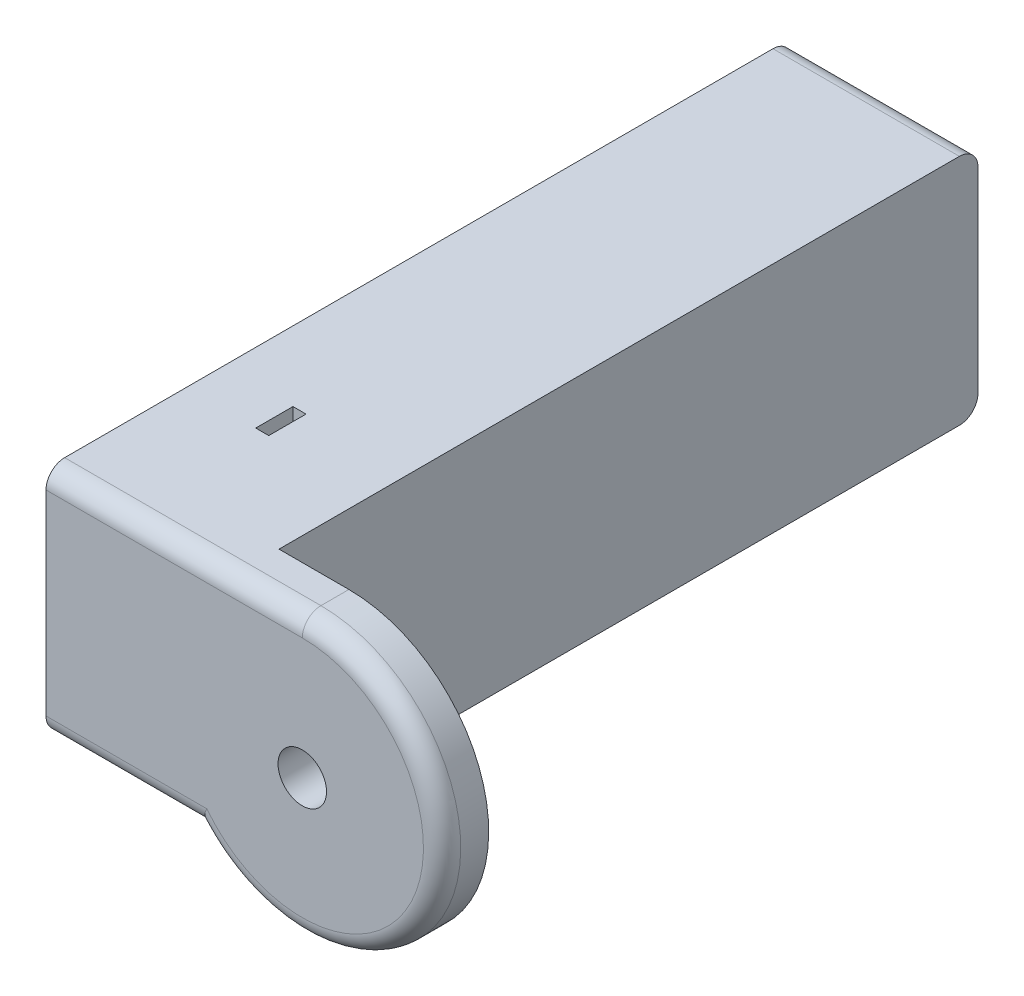
from build123d import *

# Parameters (mm, degrees)
SKETCH1_W             = 25.4
SKETCH1_H             = 101.6
TOP_DEPTH             = 4.7625
SKETCH2_W             = 25.4
SKETCH2_H             = 101.6
SKETCH2_W_2           = 15.875
SKETCH2_H_2           = 88.9
WALLS_DEPTH           = 31.75
SKETCH9_R             = 3.302
JOINT_HINGE_DEPTH     = 6.35
SKETCH3_R             = 3.175
SHAFT_HOLES_DEPTH     = 23.876
SKETCH13_W            = 1.778
SKETCH13_H            = 5.08
WIRE_LOFT_MOUNT_DEPTH = 12.7
FILLET1_R             = 2.54


with BuildPart() as part:
    # Sketch1 → Top (new body)
    with BuildSketch(Plane(origin=(0, 0, 0), x_dir=(1, 0, 0), z_dir=(0, 1, 0))):
        Rectangle(SKETCH1_W, SKETCH1_H)
    extrude(amount=TOP_DEPTH)

    # Sketch2 → Walls (add)
    with BuildSketch(Plane(origin=(0, 4.7625, 0), x_dir=(1, 0, 0), z_dir=(0, 1, 0))):
        Rectangle(SKETCH2_W, SKETCH2_H)
        Rectangle(SKETCH2_W_2, SKETCH2_H_2, mode=Mode.SUBTRACT)
    extrude(amount=-WALLS_DEPTH)

    # Sketch9 → Joint Hinge (add)
    with BuildSketch(Plane(origin=(0, 0, 50.8), x_dir=(-1, 0, 0), z_dir=(0, 0, -1))):
        with BuildLine():
            Line((-22.225, 4.7625), (-12.7, 4.7625))
            Line((-12.7, 4.7625), (-12.7, -26.9875))
            Line((-12.7, -26.9875), (-8.025968343, -26.9875))
            ThreePointArc((-8.025968343, -26.9875), (-39.615191201, -22.064629933), (-22.225, 4.7625))
        make_face()
        with Locations((-22.225, -14.2875)):
            Circle(SKETCH9_R, mode=Mode.SUBTRACT)
    extrude(amount=JOINT_HINGE_DEPTH)

    # Sketch3 → Shaft holes (cut)
    with BuildSketch(Plane.ZY.offset(12.7)):
        with Locations((38.1, -11.1125)):
            Circle(SKETCH3_R)
        with BuildLine():
            Line((-25.601638938, -12.7), (-23.061638938, -12.7))
            Line((-23.061638938, -12.7), (-23.061638938, -9.525))
            Line((-23.061638938, -9.525), (-25.601638938, -9.525))
            ThreePointArc((-25.601638938, -9.525), (-38.1, -11.1125), (-25.601638938, -12.7))
        make_face()
    extrude(amount=-SHAFT_HOLES_DEPTH, mode=Mode.SUBTRACT)

    # Sketch13 → Wire Loft Mount (cut)
    with BuildSketch(Plane.XZ):
        with Locations((-2.286, 29.21)):
            Rectangle(SKETCH13_W, SKETCH13_H)
    extrude(amount=-WIRE_LOFT_MOUNT_DEPTH, mode=Mode.SUBTRACT)

    # Fillet1
    fillet1_edges = [part.edges().sort_by_distance(p)[0] for p in [
        (0, -26.9875, -50.8),
        (-2.337015829, -26.9875, 50.8),
        (39.615191201, -22.064629933, 50.8),
        (4.7625, 4.7625, 50.8),
        (0, 4.7625, -50.8),
    ]]
    fillet(fillet1_edges, radius=FILLET1_R)


solid = part.part
